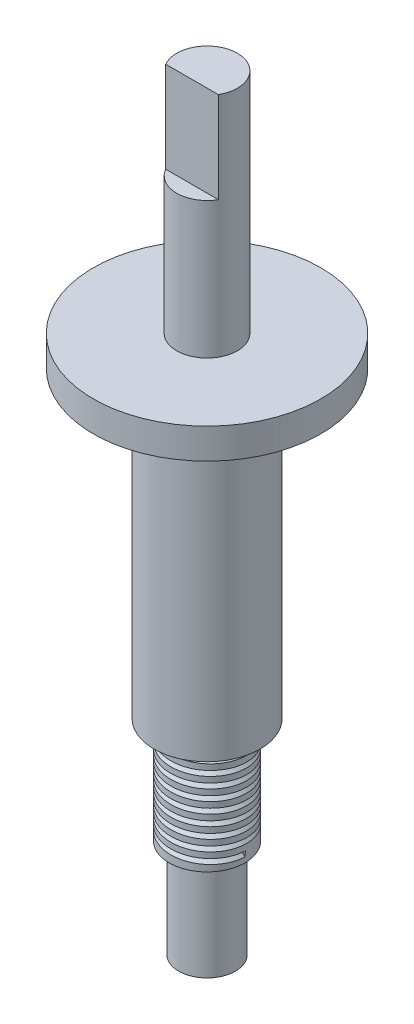
from build123d import *

# Parameters (mm, degrees)
SKETCH1_R           = 15
BOSS_EXTRUDE1_DEPTH = 101
SKETCH2_OUTSIDE_W   = 53.91
SKETCH2_OUTSIDE_H   = 53.91
SKETCH2_OUTSIDE_R   = 4
CUT_EXTRUDE1_DEPTH  = 30
SKETCH3_OUTSIDE_W   = 53.91
SKETCH3_OUTSIDE_H   = 53.91
SKETCH3_OUTSIDE_R   = 7
CUT_EXTRUDE2_DEPTH  = 67
SKETCH4_OUTSIDE_W   = 53.91
SKETCH4_OUTSIDE_H   = 53.91
SKETCH4_OUTSIDE_R   = 5
CUT_EXTRUDE5_DEPTH  = 27
SKETCH6_OUTSIDE_W   = 53.91
SKETCH6_OUTSIDE_H   = 53.91
SKETCH6_OUTSIDE_R   = 3.75
CUT_EXTRUDE6_DEPTH  = 13
CUT_SWEEP1_PITCH    = 1.4375
CUT_SWEEP1_FROM     = 0
CUT_EXTRUDE7_DEPTH  = 12
CUT_EXTRUDE8_DEPTH  = 10


with BuildPart() as part:
    # Sketch1 → Boss-Extrude1 (new body)
    with BuildSketch(Plane(origin=(0, 0, 0), x_dir=(1, 0, 0), z_dir=(0, 1, 0))):
        with Locations(Location((0, 0, 0), (0, 0, 90))):
            Circle(SKETCH1_R)
    extrude(amount=BOSS_EXTRUDE1_DEPTH)

    # Sketch2 outside → Cut-Extrude1 (cut)
    with BuildSketch(Plane(origin=(0, 101, 0), x_dir=(1, 0, 0), z_dir=(0, 1, 0))):
        Rectangle(SKETCH2_OUTSIDE_W, SKETCH2_OUTSIDE_H)
        with Locations(Location((0, 0, 0), (0, 0, 270))):
            Circle(SKETCH2_OUTSIDE_R, mode=Mode.SUBTRACT)
    extrude(amount=-CUT_EXTRUDE1_DEPTH, mode=Mode.SUBTRACT)

    # Sketch3 outside → Cut-Extrude2 (cut)
    with BuildSketch(Plane.XZ):
        Rectangle(SKETCH3_OUTSIDE_W, SKETCH3_OUTSIDE_H)
        with Locations(Location((0, 0, 0), (0, 0, 270))):
            Circle(SKETCH3_OUTSIDE_R, mode=Mode.SUBTRACT)
    extrude(amount=-CUT_EXTRUDE2_DEPTH, mode=Mode.SUBTRACT)

    # Sketch4 outside → Cut-Extrude5 (cut)
    with BuildSketch(Plane.XZ):
        Rectangle(SKETCH4_OUTSIDE_W, SKETCH4_OUTSIDE_H)
        with Locations(Location((0, 0, 0), (0, 0, 270))):
            Circle(SKETCH4_OUTSIDE_R, mode=Mode.SUBTRACT)
    extrude(amount=-CUT_EXTRUDE5_DEPTH, mode=Mode.SUBTRACT)

    # Sketch6 outside → Cut-Extrude6 (cut)
    with BuildSketch(Plane.XZ):
        Rectangle(SKETCH6_OUTSIDE_W, SKETCH6_OUTSIDE_H)
        with Locations(Location((0, 0, 0), (0, 0, 270))):
            Circle(SKETCH6_OUTSIDE_R, mode=Mode.SUBTRACT)
    extrude(amount=-CUT_EXTRUDE6_DEPTH, mode=Mode.SUBTRACT)

    # Cut-Sweep1: arcs per turn and ends read off the stored shape
    # Cut-Sweep1: the profile of Sketch9 screwed along a left-hand helix through 11 turns, 8 arcs to a turn; built about Z, then put on its axis
    cut_sweep1_z = Axis((0, 0, 0), (0, 0, 1))
    cut_sweep1_corners = [(-4.481119356, 0.040580536, -3.043119657), (-7.157674381, 0.068774526, -3.659286834), (-6.353571622, -0.051274826, -1.035661365)]
    with BuildLine(mode=Mode.PRIVATE) as cut_sweep1_profile:
        Line(cut_sweep1_corners[0], cut_sweep1_corners[1])
        Line(cut_sweep1_corners[1], cut_sweep1_corners[2])
        Line(cut_sweep1_corners[2], cut_sweep1_corners[0])
    cut_sweep1_cap = Face(cut_sweep1_profile.wire())
    cut_sweep1_turn_angles = [0, -22.5, -45, -67.5, -90, -112.5, -135, -157.5, -180, -202.5, -225, -247.5, -270, -292.5, -315, -337.5, -360]
    cut_sweep1_turn_weights = [1, 0.9238795325112867, 1, 0.9238795325112867, 1, 0.9238795325112867, 1, 0.9238795325112867, 1, 0.9238795325112867, 1, 0.9238795325112867, 1, 0.9238795325112867, 1, 0.9238795325112867, 1]
    cut_sweep1_turn_rails = [Edge.make_bspline([Vector(p[0], p[1], 0).rotate(cut_sweep1_z, cut_sweep1_turn_angles[k]) / cut_sweep1_turn_weights[k] + Vector(0, 0, p[2] + -CUT_SWEEP1_PITCH * cut_sweep1_turn_angles[k] / 360) for k in range(17)], [0, 0, 0, 1, 1, 2, 2, 3, 3, 4, 4, 5, 5, 6, 6, 7, 7, 8, 8, 8], 2, cut_sweep1_turn_weights) for p in cut_sweep1_corners]
    cut_sweep1_turn_sides = [Face.make_surface_from_curves(cut_sweep1_turn_rails[p[0]], cut_sweep1_turn_rails[p[1]]) for p in [(0, 1), (1, 2), (2, 0)]]
    cut_sweep1 = Plane(origin=(0, 27, 0), x_dir=(-1, 0, 0), z_dir=(0, -1, 0)) * split(Solid(Shell([*[p.moved(Location((0, 0, CUT_SWEEP1_PITCH * i))) for i in range(11) for p in cut_sweep1_turn_sides], cut_sweep1_cap, cut_sweep1_cap.rotate(cut_sweep1_z, -3960).moved(Location((0, 0, -CUT_SWEEP1_PITCH * -3960 / 360)))])), bisect_by=Plane.XY.offset(CUT_SWEEP1_FROM), keep=Keep.TOP, mode=Mode.PRIVATE)
    add(cut_sweep1, mode=Mode.SUBTRACT)

    # Sketch10 → Cut-Extrude7 (cut)
    with BuildSketch(Plane(origin=(0, 101, 0), x_dir=(1, 0, 0), z_dir=(0, 1, 0))):
        with BuildLine():
            Line((3.473854642, -1.983011327), (-3.473854642, -1.983011327))
            ThreePointArc((-3.473854642, -1.983011327), (0, -4), (3.473854642, -1.983011327))
        make_face()
    extrude(amount=-CUT_EXTRUDE7_DEPTH, mode=Mode.SUBTRACT)

    # Sketch12 → Cut-Extrude8 (cut)
    with BuildSketch(Plane.XY.offset(-5)):
        with BuildLine():
            Line((-2.182983152, 29.056408202), (-2.182983152, 63.056408202))
            ThreePointArc((-2.182983152, 63.056408202), (-0.432983152, 64.806408202), (1.317016848, 63.056408202))
            Line((1.317016848, 63.056408202), (1.317016848, 29.056408202))
            ThreePointArc((1.317016848, 29.056408202), (-0.432983152, 27.306408202), (-2.182983152, 29.056408202))
        make_face()
    extrude(amount=-CUT_EXTRUDE8_DEPTH, mode=Mode.SUBTRACT)


solid = part.part
